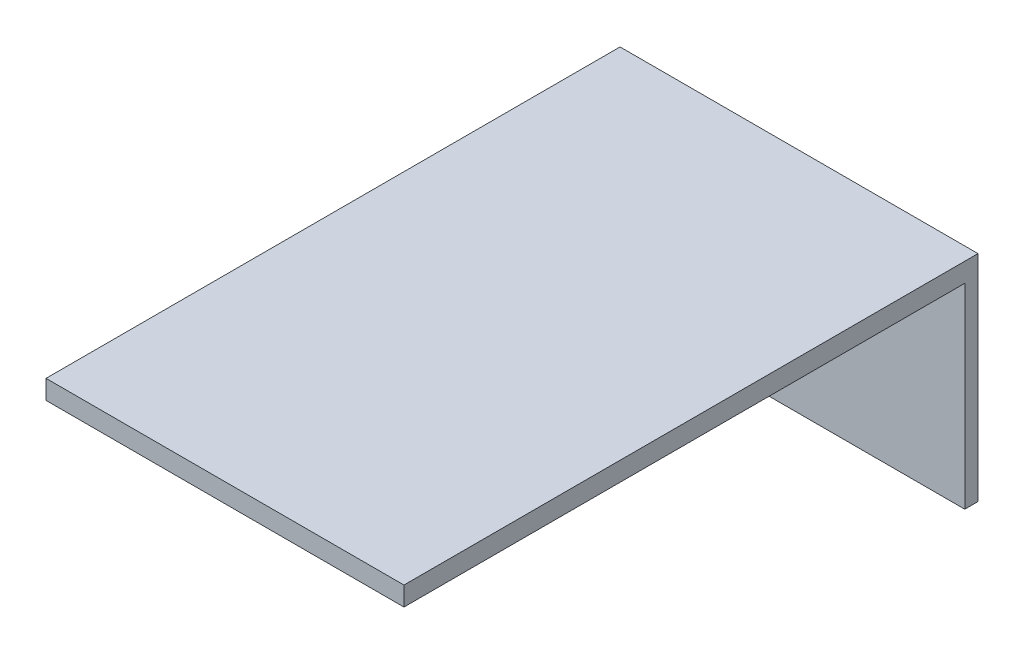
from build123d import *

# Parameters (mm, degrees)
SKIZZE1_W                       = 1000
SKIZZE1_H                       = 600
AUFSATZ_LINEAR_AUSTRAGEN1_DEPTH = 37
SKIZZE2_W                       = 1000
SKIZZE2_H                       = 53.401164718
AUFSATZ_LINEAR_AUSTRAGEN2_DEPTH = 1566.7


with BuildPart() as part:
    # Skizze1 → Aufsatz-Linear austragen1 (new body)
    with BuildSketch(Plane.XY):
        Rectangle(SKIZZE1_W, SKIZZE1_H)
    extrude(amount=AUFSATZ_LINEAR_AUSTRAGEN1_DEPTH)

    # Skizze2 → Aufsatz-Linear austragen2 (add)
    with BuildSketch(Plane.XY.offset(37)):
        with Locations((0, 273.299417641)):
            Rectangle(SKIZZE2_W, SKIZZE2_H)
    extrude(amount=AUFSATZ_LINEAR_AUSTRAGEN2_DEPTH)


solid = part.part
